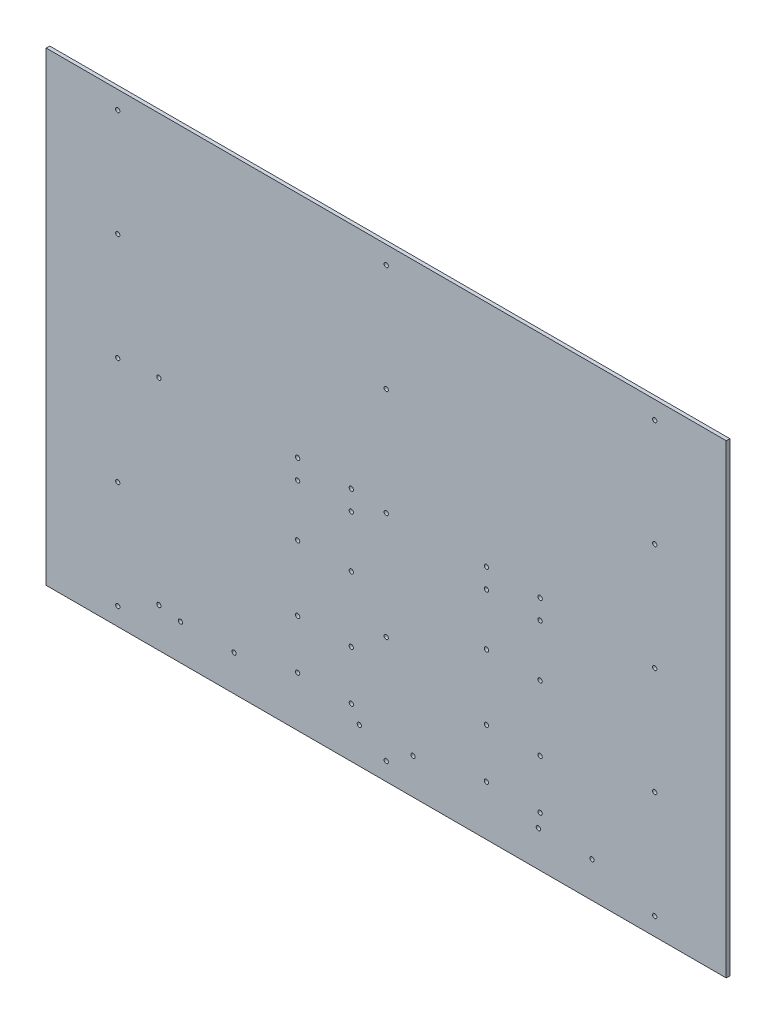
from build123d import *

# Parameters (mm, degrees)
SZKIC1_W                    = 1900
SZKIC1_H                    = 1300
DODANIE_WYCI_GNI_CIE1_DEPTH = 10
OTW_R_POD_RUB_M101_D        = 12
SZYK_LINIOWY1_COUNT         = 5
SZYK_LINIOWY1_PITCH         = 300
SZYK_LINIOWY1_COUNT_DIR2    = 3
SZYK_LINIOWY1_PITCH_DIR2    = 750
OTW_R_POD_RUB_M103_D        = 12
OTW_R_POD_RUB_M104_D        = 12
OTW_R_POD_RUB_M105_D        = 12
OTW_R_POD_RUB_M106_D        = 12


with BuildPart() as part:
    # Szkic1 → Dodanie-wyciągnięcie1 (new body)
    with BuildSketch(Plane.XY):
        Rectangle(SZKIC1_W, SZKIC1_H)
    extrude(amount=DODANIE_WYCI_GNI_CIE1_DEPTH)

    # Otwór pod śrubę M101 (through all)
    with Locations(Plane.XY.offset(10)):
        with Locations((-750, -600)):
            otw_r_pod_rub_m101 = Hole(OTW_R_POD_RUB_M101_D / 2)

    # Szyk liniowy1: Otw_r pod _rub_ M101 5 × 3
    with Locations(*[(j * SZYK_LINIOWY1_PITCH_DIR2, i * SZYK_LINIOWY1_PITCH, 0) for i in range(SZYK_LINIOWY1_COUNT) for j in range(SZYK_LINIOWY1_COUNT_DIR2) if (i, j) != (0, 0)]):
        add(otw_r_pod_rub_m101, mode=Mode.SUBTRACT)

    # Otwór pod śrubę M103 (through all)
    with Locations(Plane.XY.offset(10)):
        with Locations((-75, -550), (75, -550)):
            Hole(OTW_R_POD_RUB_M103_D / 2)

    # Otwór pod śrubę M104 (through all)
    with Locations(Plane.XY.offset(10)):
        with Locations((-575, -550), (-425, -550), (425, -550), (575, -550)):
            Hole(OTW_R_POD_RUB_M104_D / 2)

    # Otwór pod śrubę M105 (through all)
    with Locations(Plane.XY.offset(10)):
        with Locations((-634.999999999, -539.999999999), (-634.999999999, 10.000000001)):
            Hole(OTW_R_POD_RUB_M105_D / 2)

    # Otwór pod śrubę M106 (through all)
    with Locations(Plane.XY.offset(10)):
        with Locations((-247.5, -510), (-97.5, -510), (-97.5, -372.5), (-247.5, -372.5), (-97.5, -190), (-247.5, -190), (-247.5, -45), (-97.5, -45), (-97.5, 10), (-247.5, 10), (280, 10), (430, 10), (430, -45), (280, -45), (280, -190), (430, -190), (280, -372.5), (430, -372.5), (430, -510), (280, -510)):
            Hole(OTW_R_POD_RUB_M106_D / 2)


solid = part.part
